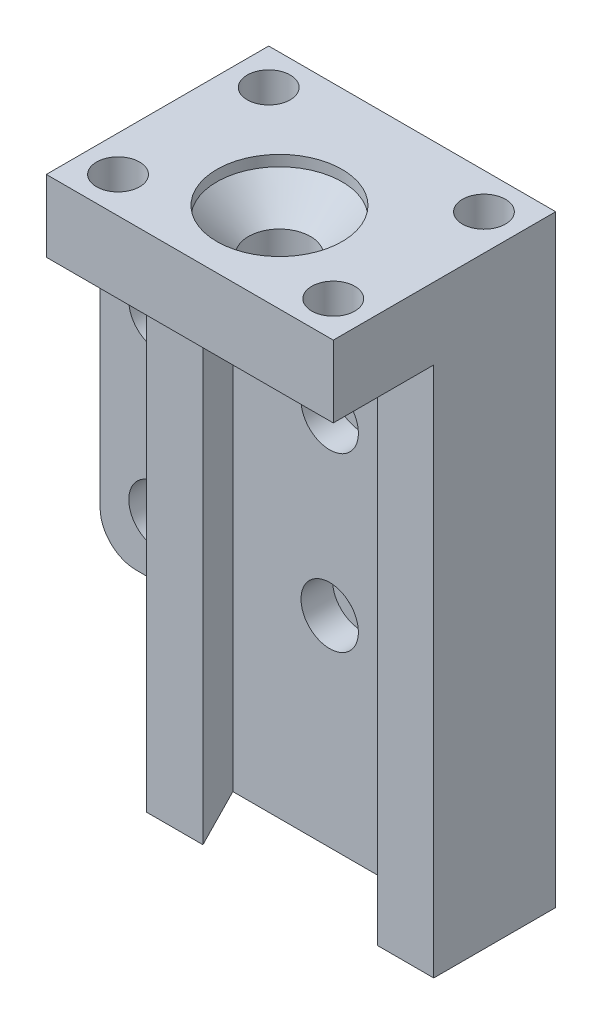
from build123d import *

# Parameters (mm, degrees)
BOSS_EXTRUDE1_OUTLINE_W                             = 55
BOSS_EXTRUDE1_OUTLINE_H                             = 40
BOSS_EXTRUDE1_DEPTH                                 = 10
SKETCH5_W                                           = 40
SKETCH5_H                                           = 14
BOSS_EXTRUDE2_DEPTH                                 = 40
CUT_EXTRUDE3_DEPTH                                  = 74
SKETCH7_W                                           = 40
SKETCH7_H                                           = 6
BOSS_EXTRUDE3_DEPTH                                 = 14
SKETCH11_W                                          = 40
SKETCH11_H                                          = 28
BOSS_EXTRUDE5_DEPTH                                 = 4
SKETCH12_W                                          = 40
SKETCH12_H                                          = 24
SKETCH12_H_2                                        = 20
BOSS_EXTRUDE6_DEPTH                                 = 3
FILLET1_R                                           = 5
SKETCH23_R                                          = 3
CUT_EXTRUDE11_DEPTH                                 = 10
SKETCH26_R                                          = 4.325
CUT_EXTRUDE12_DEPTH                                 = 4.1
CUT_EXTRUDE13_DEPTH                                 = 1.5
CBORE_FOR_M4_HEX_SOCKET_HEAD_CAP_SCREW1_D           = 4.5
CBORE_FOR_M4_HEX_SOCKET_HEAD_CAP_SCREW1_CBORE_D     = 8
CBORE_FOR_M4_HEX_SOCKET_HEAD_CAP_SCREW1_CBORE_DEPTH = 4.4


# Read off the part's stored shape, not the designer's step: Boss-Extrude1
with BuildPart() as part:
    # Boss-Extrude1 outline → Boss-Extrude1 (new body)
    with BuildSketch(Plane.XY):
        with Locations((7.5, 0)):
            Rectangle(BOSS_EXTRUDE1_OUTLINE_W, BOSS_EXTRUDE1_OUTLINE_H)
    extrude(amount=BOSS_EXTRUDE1_DEPTH)

    # Sketch5 → Boss-Extrude2 (add, symmetric)
    with BuildSketch(Plane(origin=(0, 0, 0), x_dir=(1, 0, 0), z_dir=(0, 1, 0))):
        with Locations((15, -10)):
            Rectangle(SKETCH5_W, SKETCH5_H)
    extrude(amount=BOSS_EXTRUDE2_DEPTH, both=True)

    # Sketch6 → Cut-Extrude3 (cut)
    with BuildSketch(Plane(origin=(0, 34, 0), x_dir=(1, 0, 0), z_dir=(0, 1, 0))):
        Polygon((-1.5, -8.5), (31.5, -8.5), (27.169033679, -17), (2.830966321, -17), align=None)
    extrude(amount=-CUT_EXTRUDE3_DEPTH, mode=Mode.SUBTRACT)

    # Sketch7 → Boss-Extrude3 (add)
    with BuildSketch(Plane.XY.offset(17)):
        with Locations((15, 37)):
            Rectangle(SKETCH7_W, SKETCH7_H)
    extrude(amount=BOSS_EXTRUDE3_DEPTH)

    # Sketch11 → Boss-Extrude5 (add)
    with BuildSketch(Plane(origin=(0, 40, 0), x_dir=(1, 0, 0), z_dir=(0, 1, 0))):
        with Locations((15, -17)):
            Rectangle(SKETCH11_W, SKETCH11_H)
    extrude(amount=BOSS_EXTRUDE5_DEPTH)

    # Sketch12 → Boss-Extrude6 (add)
    with BuildSketch(Plane(origin=(0, 0, 3), x_dir=(-1, 0, 0), z_dir=(0, 0, -1))):
        with Locations((-15, 32)):
            Rectangle(SKETCH12_W, SKETCH12_H)
        with Locations((-15, -30)):
            Rectangle(SKETCH12_W, SKETCH12_H_2)
    extrude(amount=BOSS_EXTRUDE6_DEPTH)

    # Fillet1
    fillet1_edges = [part.edges().sort_by_distance(p)[0] for p in [
        (-5, -20, 5),
        (-5, 20, 5),
        (-20, 20, 5),
        (-20, -20, 5),
    ]]
    fillet(fillet1_edges, radius=FILLET1_R)

    # Sketch23 → Cut-Extrude11 (cut)
    with BuildSketch(Plane(origin=(0, 44, 0), x_dir=(1, 0, 0), z_dir=(0, 1, 0))):
        with Locations(Location((0, -5, 0), (0, 0, 180))):
            Circle(SKETCH23_R)
        with Locations(Location((30, -5, 0), (0, 0, 180))):
            Circle(SKETCH23_R)
        with Locations(Location((30, -26, 0), (0, 0, 180))):
            Circle(SKETCH23_R)
        with Locations(Location((0, -26, 0), (0, 0, 180))):
            Circle(SKETCH23_R)
    extrude(amount=-CUT_EXTRUDE11_DEPTH, mode=Mode.SUBTRACT)

    # Sketch25 → Cut-Revolve1 (revolve, cut)
    with BuildSketch(Plane.XY.offset(18.5), mode=Mode.PRIVATE) as cut_revolve1_sk:
        Polygon((15, 44), (15, 38.1), (19.325, 38.1), (23.725, 42.5), (23.725, 44), align=None)
    revolve(cut_revolve1_sk.sketch.rotate(Axis((15, 44, 18.5), (0, -1, 0)), 90), axis=Axis((15, 44, 18.5), (0, -1, 0)), mode=Mode.SUBTRACT)

    # Sketch26 → Cut-Extrude12 (cut)
    with BuildSketch(Plane(origin=(0, 38.1, 0), x_dir=(1, 0, 0), z_dir=(0, 1, 0))):
        with Locations(Location((15, -18.5, 0), (0, 0, 270))):
            Circle(SKETCH26_R)
    extrude(amount=-CUT_EXTRUDE12_DEPTH, mode=Mode.SUBTRACT)

    # Sketch28 → Cut-Extrude13 (cut)
    with BuildSketch(Plane.XY.offset(10)):
        with BuildLine():
            Line((-15, -20), (-10, -20))
            ThreePointArc((-10, -20), (-6.464466094, -21.464466094), (-5, -25))
            Line((-5, -25), (-5, 25))
            ThreePointArc((-5, 25), (-6.464466094, 21.464466094), (-10, 20))
            Line((-10, 20), (-15, 20))
            ThreePointArc((-15, 20), (-18.535533906, 18.535533906), (-20, 15))
            Line((-20, 15), (-20, -15))
            ThreePointArc((-20, -15), (-18.535533906, -18.535533906), (-15, -20))
        make_face()
    extrude(amount=-CUT_EXTRUDE13_DEPTH, mode=Mode.SUBTRACT)

    # CBORE for M4 Hex Socket Head Cap Screw1 (through all)
    with Locations(Plane.XY.offset(8.5)):
        with Locations((-12, 12), (12, 12), (12, -12), (-12, -12)):
            CounterBoreHole(CBORE_FOR_M4_HEX_SOCKET_HEAD_CAP_SCREW1_D / 2, CBORE_FOR_M4_HEX_SOCKET_HEAD_CAP_SCREW1_CBORE_D / 2, CBORE_FOR_M4_HEX_SOCKET_HEAD_CAP_SCREW1_CBORE_DEPTH)


solid = part.part
